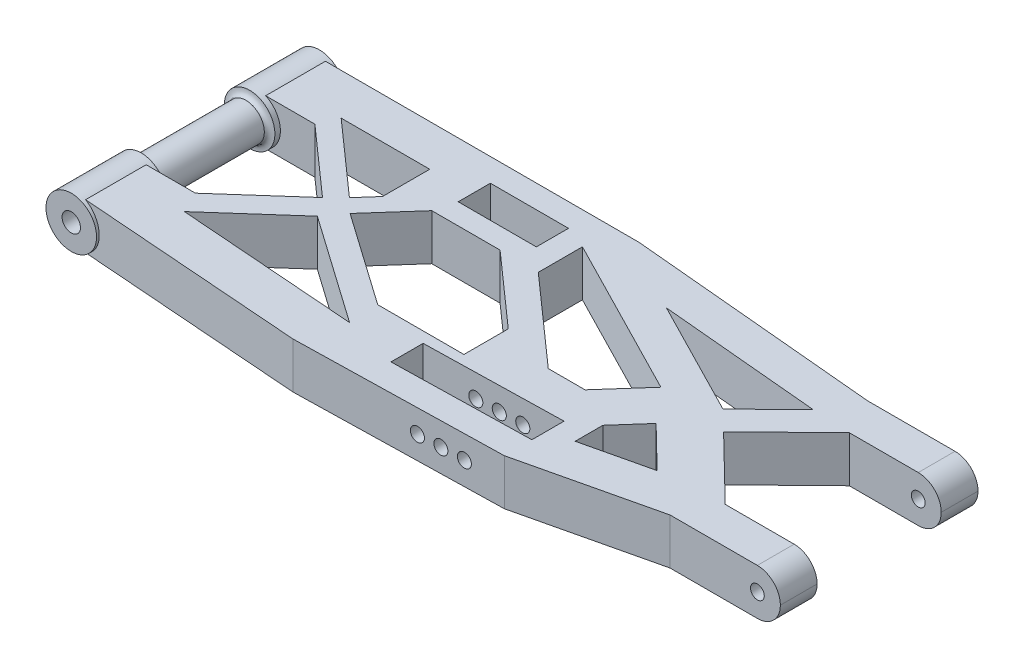
from build123d import *

# Parameters (mm, degrees)
RESSALTO_EXTRUS_O1_DEPTH = 10
ESBO_O4_W                = 13
ESBO_O4_H                = 26
CORTE_EXTRUS_O1_DEPTH    = 153.557132499
ESBO_O5_R                = 2
CORTE_EXTRUS_O2_DEPTH    = 160.086317259
ESBO_O6_W                = 27
ESBO_O6_H                = 10
CORTE_EXTRUS_O3_DEPTH    = 20
FILETE1_R                = 5
FILETE2_R                = 5
ESBO_O7_R                = 1.5
CORTE_EXTRUS_O4_DEPTH    = 158.459379965
ESBO_O8_R                = 1.5
CORTE_EXTRUS_O5_DEPTH    = 20
ESBO_O10_W               = 17
ESBO_O10_H               = 7
CORTE_EXTRUS_O8_DEPTH    = 10


with BuildPart() as part:
    # Esboço1 → Ressalto-extrusão1 (new body)
    with BuildSketch(Plane(origin=(0, 0, 0), x_dir=(1, 0, 0), z_dir=(0, 1, 0))):
        Polygon((0, -26), (0, 26), (70.5, 26), (125.272255751, 21), (149.272255751, 21), (149.272255751, -22), (125.272255751, -22), (96.066533251, -28.85753405), (51.077645734, -29.85753405), align=None)
    extrude(amount=RESSALTO_EXTRUS_O1_DEPTH)

    # Esboço4 → Corte-extrusão1 (cut, through all)
    with BuildSketch(Plane(origin=(0, 10, 0), x_dir=(1, 0, 0), z_dir=(0, 1, 0))):
        with Locations((6.5, 0)):
            Rectangle(ESBO_O4_W, ESBO_O4_H)
    extrude(amount=-CORTE_EXTRUS_O1_DEPTH, mode=Mode.SUBTRACT)

    # Esboço2 → Revolução1 (revolve)
    with BuildSketch(Plane.ZY, mode=Mode.PRIVATE) as revolu_o1_sk:
        with BuildLine():
            Line((-27, 5), (-27, 10.5))
            Line((-27, 10.5), (-11.8, 10.5))
            add(Edge.make_bspline(
                [(-11.8, 10.5), (-11.799257972, 9.25000022), (-11, 9)],
                knots=[0, 0, 0, 1, 1, 1], degree=2))
            Line((-11, 9), (11, 9))
            add(Edge.make_bspline(
                [(11.8, 10.5), (11.782356414, 9.025535941), (11, 9)],
                knots=[0, 0, 0, 1, 1, 1], degree=2))
            Line((11.8, 10.5), (27, 10.5))
            Line((27, 10.5), (27, 5))
            Line((27, 5), (-27, 5))
        make_face()
    revolve(revolu_o1_sk.sketch.rotate(Axis((0, 5, -27), (0, 0, 1)), 90), axis=Axis((0, 5, -27), (0, 0, 1)))

    # Esboço5 → Corte-extrusão2 (cut, through all)
    with BuildSketch(Plane.XY.offset(27)):
        with Locations((0, 5)):
            Circle(ESBO_O5_R)
    extrude(amount=-CORTE_EXTRUS_O2_DEPTH, mode=Mode.SUBTRACT)

    # Esboço6 → Corte-extrusão3 (cut)
    with BuildSketch(Plane(origin=(149.272255751, 0, 0), x_dir=(0, 0, -1), z_dir=(1, 0, 0))):
        with Locations((-0.5, 5)):
            Rectangle(ESBO_O6_W, ESBO_O6_H)
    extrude(amount=-CORTE_EXTRUS_O3_DEPTH, mode=Mode.SUBTRACT)

    # Filete1
    filete1_edges = [part.edges().sort_by_distance(p)[0] for p in [
        (149.272255751, 10, 18),
    ]]
    fillet(filete1_edges, radius=FILETE1_R)

    # Filete2
    filete2_edges = [part.edges().sort_by_distance(p)[0] for p in [
        (149.272255751, 0, -17),
        (149.272255751, 10, -17),
        (149.272255751, 0, 18),
    ]]
    fillet(filete2_edges, radius=FILETE2_R - 0.0001)  # a hair under: the kernel refuses the full size

    # Esboço7 → Corte-extrusão4 (cut, through all)
    with BuildSketch(Plane.XY.offset(22)):
        with Locations((144.272255751, 5)):
            Circle(ESBO_O7_R)
    extrude(amount=-CORTE_EXTRUS_O4_DEPTH, mode=Mode.SUBTRACT)

    # Esboço8 → Corte-extrusão5 (cut)
    with BuildSketch(Plane(origin=(0.688560438, 0, 30.977568087), x_dir=(0.9997530559290662, 0, -0.02222222222222223), z_dir=(0.02222222222222223, 0, 0.9997530559290662))):
        with Locations((86.901531655, 5)):
            Circle(ESBO_O8_R)
        with Locations((81.901531655, 5)):
            Circle(ESBO_O8_R)
        with Locations((76.901531655, 5)):
            Circle(ESBO_O8_R)
    extrude(amount=-CORTE_EXTRUS_O5_DEPTH, mode=Mode.SUBTRACT)

    # Esboço10 → Corte-extrusão8 (cut)
    with BuildSketch(Plane(origin=(0, 10, 0), x_dir=(1, 0, 0), z_dir=(0, 1, 0))):
        Polygon((96.066533251, -22.85605202), (66.073941573, -23.522718687), (66.073941573, -16.522718687), (96.066533251, -15.85605202), align=None)
        Polygon((13, 13), (27.658080306, 0), (13, -13), align=None)
        Polygon((14.715215875, 17), (30.605506577, 2.907173735), (33.988145027, 6.721249585), (33.988145027, 17), align=None)
        Polygon((30.605506577, -4.06909346), (15.267814751, -17.67182926), (54.15706585, -20.608859895), align=None)
        Polygon((33.658080306, 0), (42.012333551, 9.419793458), (56.871686456, 9.419793458), (72.605550348, -4.534300553), (72.605550348, -14.178506447), (53.847357844, -14.178506447), align=None)
        with Locations((51.715539775, 17.466082457)):
            Rectangle(ESBO_O10_W, ESBO_O10_H)
        Polygon((85.85936677, 16.625472682), (111.060316292, 3.717254981), (121.012658968, 13.416430831), align=None)
        Polygon((129.272255751, -14), (115.419880228, -0.5), (129.272255751, 13), align=None)
        Polygon((65.215539775, 18.996331638), (65.215539775, 9.387469518), (84.442487674, -7.664580783), (92.451959357, -7.664580783), (100.203174703, 1.075260526), align=None)
        Polygon((115.511410207, -15.047093106), (106.507920849, -6.272633726), (101.066533251, -12.408041141), (101.066533251, -18.438765254), align=None)
    extrude(amount=-CORTE_EXTRUS_O8_DEPTH, mode=Mode.SUBTRACT)


solid = part.part
